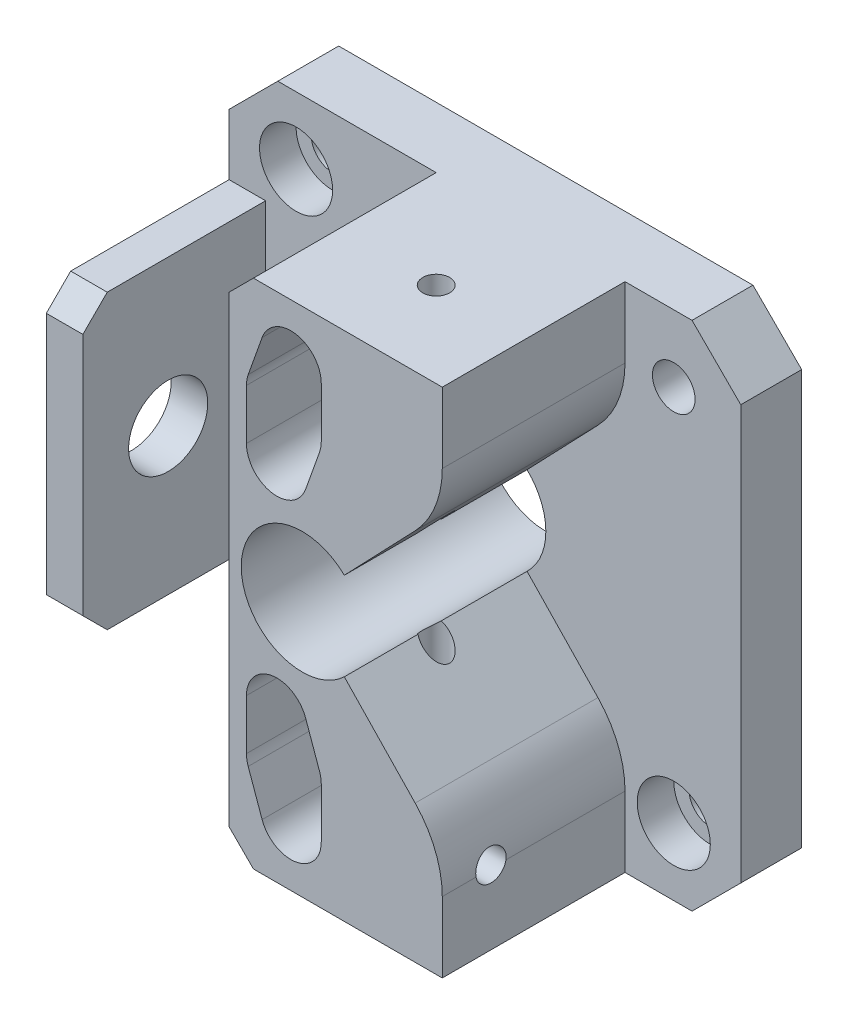
from build123d import *

# Parameters (mm, degrees)
SCHIZZO1_W                   = 42
SCHIZZO1_H                   = 42
SCHIZZO1_R                   = 1.75
ESTRUSIONE_ESTRUSIONE1_DEPTH = 5
SCHIZZO3_W                   = 17.5
SCHIZZO3_H                   = 42
ESTRUSIONE_ESTRUSIONE4_DEPTH = 15
SCHIZZO4_R                   = 5
TAGLIO_ESTRUSIONE1_DEPTH     = 36.80502758
SCHIZZO6_R                   = 1.1
TAGLIO_ESTRUSIONE3_DEPTH     = 54.197744313
TAGLIO_ESTRUSIONE4_DEPTH     = 15
RACCORDO2_R                  = 8
RACCORDO3_R                  = 8
SMUSSO1_SIZE                 = 4
FORO_FILETTATO_M3_2_D        = 2.5
FORO_FILETTATO_M3_2_DEPTH    = 12
FORO_FILETTATO_M3_2_TIP      = 0.751075774
TAGLIO_ESTRUSIONE5_DEPTH     = 15
SCHIZZO28_W                  = 3
SCHIZZO28_H                  = 24
ESTRUSIONE_ESTRUSIONE5_DEPTH = 15
SCHIZZO29_R                  = 3
TAGLIO_ESTRUSIONE6_DEPTH     = 3
SMUSSO3_SIZE                 = 2
SCHIZZO30_R                  = 3.25
TAGLIO_ESTRUSIONE7_DEPTH     = 3
SMUSSO4_SIZE                 = 2


with BuildPart() as part:
    # Schizzo1 → Estrusione-Estrusione1 (new body)
    with BuildSketch(Plane.XY.offset(-25)):
        Rectangle(SCHIZZO1_W, SCHIZZO1_H)
        with Locations((-15.5, 15.5)):
            Circle(SCHIZZO1_R, mode=Mode.SUBTRACT)
        with Locations((15.5, 15.5)):
            Circle(SCHIZZO1_R, mode=Mode.SUBTRACT)
        with Locations((-15.5, -15.5)):
            Circle(SCHIZZO1_R, mode=Mode.SUBTRACT)
        with Locations((15.5, -15.5)):
            Circle(SCHIZZO1_R, mode=Mode.SUBTRACT)
    extrude(amount=ESTRUSIONE_ESTRUSIONE1_DEPTH)

    # Schizzo3 → Estrusione-Estrusione4 (add)
    with BuildSketch(Plane.XY.offset(-20)):
        with Locations((2.75, 0)):
            Rectangle(SCHIZZO3_W, SCHIZZO3_H)
    extrude(amount=ESTRUSIONE_ESTRUSIONE4_DEPTH)

    # Schizzo4 → Taglio-Estrusione1 (cut, through all)
    with BuildSketch(Plane.XY.offset(-5)):
        Circle(SCHIZZO4_R)
    extrude(amount=-TAGLIO_ESTRUSIONE1_DEPTH, mode=Mode.SUBTRACT)

    # Schizzo6 → Taglio-Estrusione3 (cut, through all)
    with BuildSketch(Plane.XZ.offset(21)):
        with Locations((4, -12)):
            Circle(SCHIZZO6_R)
    extrude(amount=-TAGLIO_ESTRUSIONE3_DEPTH, mode=Mode.SUBTRACT)

    # Schizzo7 → Taglio-Estrusione4 (cut)
    with BuildSketch(Plane.XY.offset(-5)):
        Polygon((11.5, 12), (0, 0), (11.5, -12), align=None)
    extrude(amount=-TAGLIO_ESTRUSIONE4_DEPTH, mode=Mode.SUBTRACT)

    # Raccordo2
    raccordo2_edges = [part.edges().sort_by_distance(p)[0] for p in [
        (11.5, 12, -12.5),
    ]]
    fillet(raccordo2_edges, radius=RACCORDO2_R)

    # Raccordo3
    raccordo3_edges = [part.edges().sort_by_distance(p)[0] for p in [
        (11.5, -12, -12.5),
    ]]
    fillet(raccordo3_edges, radius=RACCORDO3_R)

    # Smusso1
    smusso1_edges = [part.edges().sort_by_distance(p)[0] for p in [
        (21, -21, -22.5),
        (-21, -21, -22.5),
        (-21, 21, -22.5),
        (21, 21, -22.5),
    ]]
    chamfer(smusso1_edges, length=SMUSSO1_SIZE)

    # Foro filettato M3-2
    with Locations(Plane(origin=(11.5, 0, 0), x_dir=(0, 0, -1), z_dir=(1, 0, 0))):
        with Locations((9, -14.991390959)):
            Hole(FORO_FILETTATO_M3_2_D / 2, depth=FORO_FILETTATO_M3_2_DEPTH)
            with Locations((0, 0, -(FORO_FILETTATO_M3_2_DEPTH + FORO_FILETTATO_M3_2_TIP / 2))):  # 118° drill point
                Cone(0, FORO_FILETTATO_M3_2_D / 2, FORO_FILETTATO_M3_2_TIP, mode=Mode.SUBTRACT)

    # Schizzo25 → Taglio-Estrusione5 (cut)
    with BuildSketch(Plane.XY.offset(-5)):
        with BuildLine():
            Line((1.567495666, 16.295964266), (1.567495666, 12.171402011))
            ThreePointArc((1.567495666, 12.171402011), (1.531053149, 11.746096793), (1.422788044, 11.333190929))
            Line((1.422788044, 11.333190929), (0.280593544, 8.123734436))
            ThreePointArc((0.280593544, 8.123734436), (-2.500004051, 6.498388034), (-4.574698833, 8.961945517))
            Line((-4.574698833, 8.961945517), (-4.574698833, 13.086507773))
            ThreePointArc((-4.574698833, 13.086507773), (-4.538256316, 13.51181299), (-4.42999121, 13.924718854))
            Line((-4.42999121, 13.924718854), (-3.287796711, 17.134175347))
            ThreePointArc((-3.287796711, 17.134175347), (-0.507199116, 18.759521749), (1.567495666, 16.295964266))
        make_face()
        with BuildLine():
            Line((-4.574698833, -13.086507773), (-4.574698833, -8.961945517))
            ThreePointArc((-4.574698833, -8.961945517), (-2.500004051, -6.498388034), (0.280593544, -8.123734436))
            Line((0.280593544, -8.123734436), (1.422788044, -11.333190929))
            ThreePointArc((1.422788044, -11.333190929), (1.531053149, -11.746096793), (1.567495666, -12.171402011))
            Line((1.567495666, -12.171402011), (1.567495666, -16.295964266))
            ThreePointArc((1.567495666, -16.295964266), (-0.507199116, -18.759521749), (-3.287796711, -17.134175347))
            Line((-3.287796711, -17.134175347), (-4.42999121, -13.924718854))
            ThreePointArc((-4.42999121, -13.924718854), (-4.538256316, -13.51181299), (-4.574698833, -13.086507773))
        make_face()
    extrude(amount=-TAGLIO_ESTRUSIONE5_DEPTH, mode=Mode.SUBTRACT)

    # Schizzo28 → Estrusione-Estrusione5 (add)
    with BuildSketch(Plane.XY.offset(-20)):
        with Locations((-19.5, 0)):
            Rectangle(SCHIZZO28_W, SCHIZZO28_H)
    extrude(amount=ESTRUSIONE_ESTRUSIONE5_DEPTH)

    # Schizzo29 → Taglio-Estrusione6 (cut)
    with BuildSketch(Plane.XY.offset(-20)):
        with Locations((-15.5, 15.5)):
            Circle(SCHIZZO29_R)
        with Locations((-15.5, -15.5)):
            Circle(SCHIZZO29_R)
        with Locations((15.5, -15.5)):
            Circle(SCHIZZO29_R)
    extrude(amount=-TAGLIO_ESTRUSIONE6_DEPTH, mode=Mode.SUBTRACT)

    # Smusso3
    smusso3_edges = [part.edges().sort_by_distance(p)[0] for p in [
        (-6, -21, -12.5),
        (-6, 21, -12.5),
    ]]
    chamfer(smusso3_edges, length=SMUSSO3_SIZE)

    # Schizzo30 → Taglio-Estrusione7 (cut)
    with BuildSketch(Plane.ZY.offset(21)):
        with Locations((-12, 0)):
            Circle(SCHIZZO30_R)
    extrude(amount=-TAGLIO_ESTRUSIONE7_DEPTH, mode=Mode.SUBTRACT)

    # Smusso4
    smusso4_edges = [part.edges().sort_by_distance(p)[0] for p in [
        (-19.5, -12, -5),
        (-19.5, 12, -5),
    ]]
    chamfer(smusso4_edges, length=SMUSSO4_SIZE)


solid = part.part
